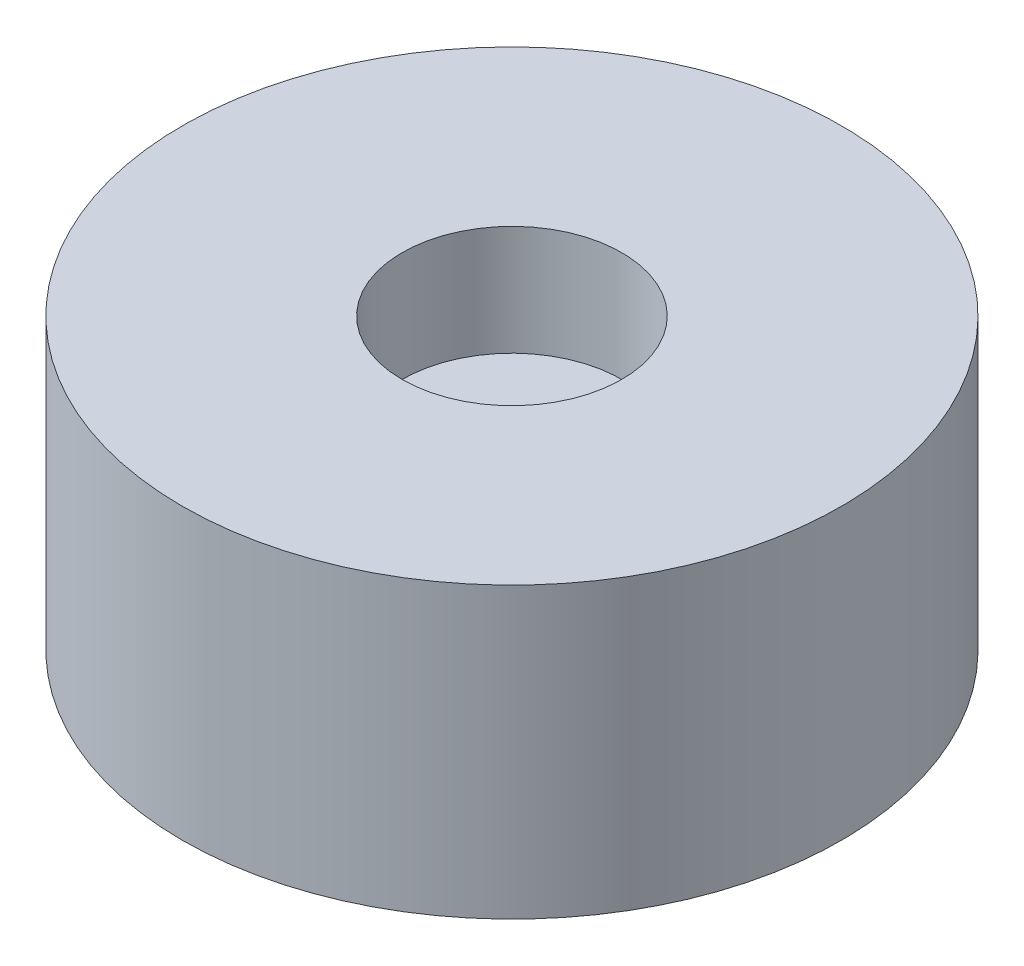
from build123d import *

# Parameters (mm, degrees)
SKETCH1_R                                       = 9
BOSS_EXTRUDE1_DEPTH                             = 7.9
SKETCH2_R                                       = 3
CUT_EXTRUDE1_DEPTH                              = 3
SKETCH3_R                                       = 3.5
BOSS_EXTRUDE2_DEPTH                             = 1.6
TAPPED_HOLE_FOR_M2_5X0_45_HELICOIL1_D           = 2.55
TAPPED_HOLE_FOR_M2_5X0_45_HELICOIL1_DEPTH       = 4
TAPPED_HOLE_FOR_M2_5X0_45_HELICOIL1_CSINK_D     = 3.195
TAPPED_HOLE_FOR_M2_5X0_45_HELICOIL1_CSINK_ANGLE = 90
TAPPED_HOLE_FOR_M2_5X0_45_HELICOIL1_TIP         = 0.766097289


with BuildPart() as part:
    # Sketch1 → Boss-Extrude1 (new body)
    with BuildSketch(Plane(origin=(0, 0, 0), x_dir=(1, 0, 0), z_dir=(0, 1, 0))):
        Circle(SKETCH1_R)
    extrude(amount=BOSS_EXTRUDE1_DEPTH)

    # Sketch2 → Cut-Extrude1 (cut)
    with BuildSketch(Plane(origin=(0, 7.9, 0), x_dir=(1, 0, 0), z_dir=(0, 1, 0))):
        Circle(SKETCH2_R)
    extrude(amount=-CUT_EXTRUDE1_DEPTH, mode=Mode.SUBTRACT)

    # Sketch3 → Boss-Extrude2 (add)
    with BuildSketch(Plane.XZ):
        Circle(SKETCH3_R)
    extrude(amount=BOSS_EXTRUDE2_DEPTH)

    # Tapped Hole for M2.5x0.45 Helicoil1
    with Locations(Plane(origin=(0, -1.6, 0), x_dir=(-1, 0, 0), z_dir=(0, -1, 0))):
        with Locations((0, 0)):
            CounterSinkHole(TAPPED_HOLE_FOR_M2_5X0_45_HELICOIL1_D / 2, TAPPED_HOLE_FOR_M2_5X0_45_HELICOIL1_CSINK_D / 2, depth=TAPPED_HOLE_FOR_M2_5X0_45_HELICOIL1_DEPTH, counter_sink_angle=TAPPED_HOLE_FOR_M2_5X0_45_HELICOIL1_CSINK_ANGLE)
            with Locations((0, 0, -(TAPPED_HOLE_FOR_M2_5X0_45_HELICOIL1_DEPTH + TAPPED_HOLE_FOR_M2_5X0_45_HELICOIL1_TIP / 2))):  # 118° drill point
                Cone(0, TAPPED_HOLE_FOR_M2_5X0_45_HELICOIL1_D / 2, TAPPED_HOLE_FOR_M2_5X0_45_HELICOIL1_TIP, mode=Mode.SUBTRACT)


solid = part.part
